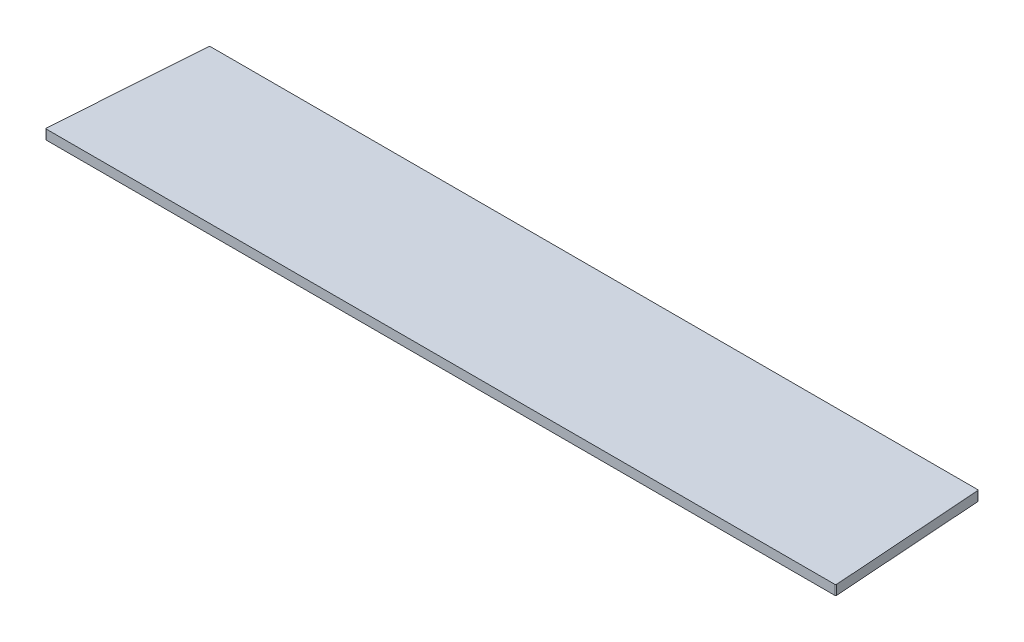
from build123d import *

# Parameters (mm, degrees)
BASE_FLANGE1_DEPTH = 10
FILLET_1_0_R       = 1


# Sheet-metal steps are written as plain solids
with BuildPart() as part:
    # Sketch1 → Base-Flange1 (new body)
    with BuildSketch(Plane(origin=(0, 0, 0), x_dir=(1, 0, 0), z_dir=(0, 1, 0))):
        Polygon((-400.811710089, 160), (400.811710089, 160), (412, 0), (-412, 0), align=None)
    extrude(amount=-BASE_FLANGE1_DEPTH)

    # Fillet-1.0
    fillet_1_0_edges = [part.edges().sort_by_distance(p)[0] for p in [
        (-400.811710089, -5, -160),
        (400.811710089, -5, -160),
        (412, -5, 0),
        (-412, -5, 0),
    ]]
    fillet(fillet_1_0_edges, radius=FILLET_1_0_R)


solid = part.part
